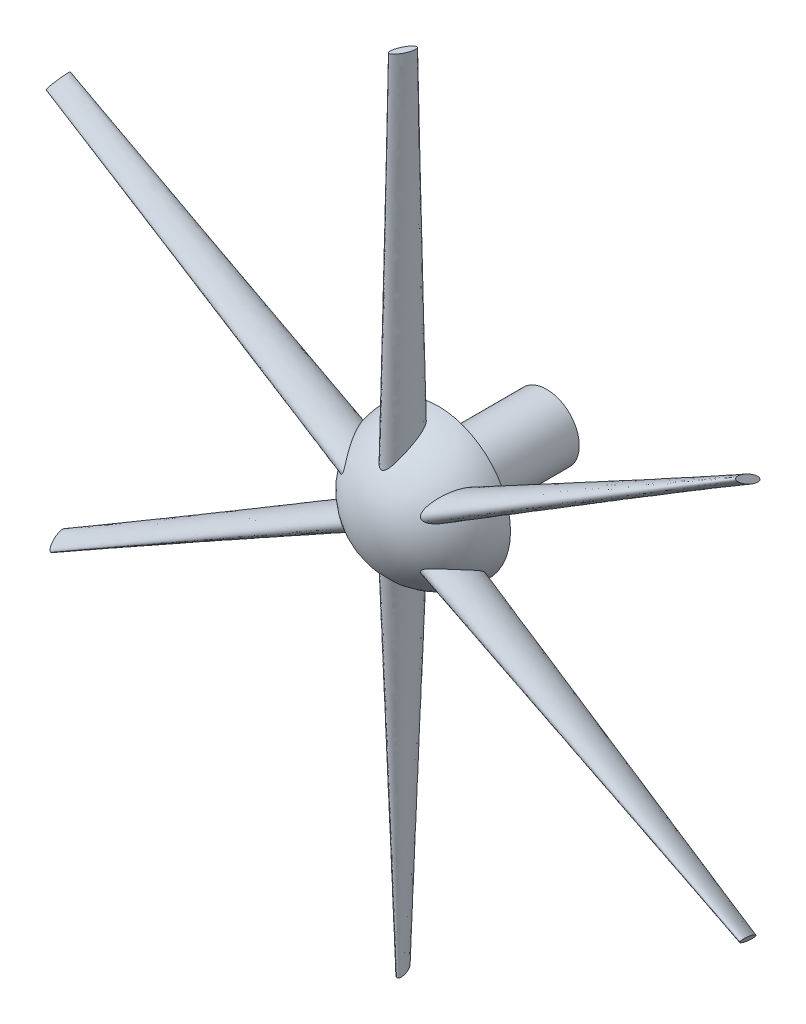
from build123d import *

# Parameters (mm, degrees)
SKETCH1_R           = 5.715
BOSS_EXTRUDE1_DEPTH = 19.05
REVOLVE2_ANGLE      = 180
CIRPATTERN1_COUNT   = 6


with BuildPart() as part:
    # Sketch1 → Boss-Extrude1 (new body)
    with BuildSketch(Plane.XY):
        with Locations(Location((0, 0, 0), (0, 0, 180))):
            Circle(SKETCH1_R)
    extrude(amount=BOSS_EXTRUDE1_DEPTH)

    # Sketch3 → Revolve2 (revolve)
    with BuildSketch(Plane.XY.offset(19.05)):
        with BuildLine():
            Line((0, 12.7), (0, -12.7))
            ThreePointArc((0, -12.7), (-12.7, 0), (0, 12.7))
        make_face()
    revolve(axis=Axis((0, 12.7, 19.05), (0, 1, 0)), revolution_arc=REVOLVE2_ANGLE)

    # Loft2: read off the stored shape, not the designer's step
    # Loft2: loft between two sections, ruled curve by curve
    loft2_from = [
        Edge.make_bspline([(0, 6.35, 21.399257076), (-3.81, 6.35, 21.399257076), (-3.81, 6.35, 29.019257076), (0, 6.35, 29.019257076), (3.81, 6.35, 29.019257076), (3.81, 6.35, 21.399257076), (0, 6.35, 21.399257076)], [0, 0, 0, 0, 0.5, 0.5, 0.5, 1, 1, 1, 1], 3, [1, 0.333333333, 0.333333333, 1, 0.333333333, 0.333333333, 1]),
    ]
    loft2_to = [
        Edge.make_bspline([(0.805087789, 69.85, 23.482740742), (-0.345923101, 69.85, 22.946015549), (-1.956098678, 69.85, 26.399048218), (-0.805087789, 69.85, 26.93577341), (0.345923101, 69.85, 27.472498603), (1.956098678, 69.85, 24.019465934), (0.805087789, 69.85, 23.482740742)], [0, 0, 0, 0, 0.5, 0.5, 0.5, 1, 1, 1, 1], 3, [1, 0.333333333, 0.333333333, 1, 0.333333333, 0.333333333, 1]),
    ]
    loft2 = Solid(Shell([*[Face.make_surface_from_curves(loft2_from[k], loft2_to[k]) for k in range(1)], Face(Wire(loft2_from)), Face(Wire(loft2_to))]))
    add(loft2)

    # CirPattern1: Loft2 ×6 about axis
    cirpattern1_axis = Axis((0, 0, 63.842193769), (0, 0, -1))
    for i in range(1, CIRPATTERN1_COUNT):
        add(loft2.rotate(cirpattern1_axis, i * 360 / CIRPATTERN1_COUNT))


solid = part.part
